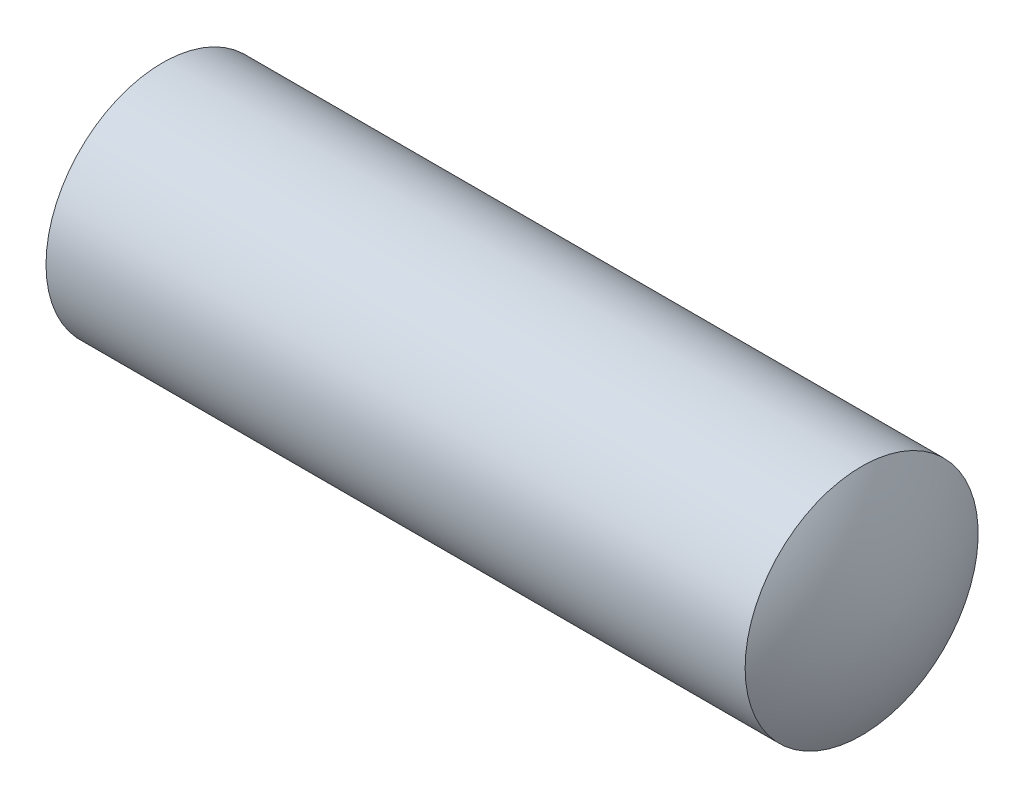
from build123d import *


with BuildPart() as part:
    # Эскиз1 → Повернуть2 (revolve)
    with BuildSketch(Plane.XY):
        with BuildLine():
            Line((0, 2), (12, 2))
            ThreePointArc((12, 2), (12.432805569, 1.039841671), (12.6, 0))
            Line((12.6, 0), (-0.6, 0))
            ThreePointArc((-0.6, 0), (-0.432805569, 1.039841671), (0, 2))
        make_face()
    revolve(axis=Axis((0, 0, 0), (1, 0, 0)))


solid = part.part
